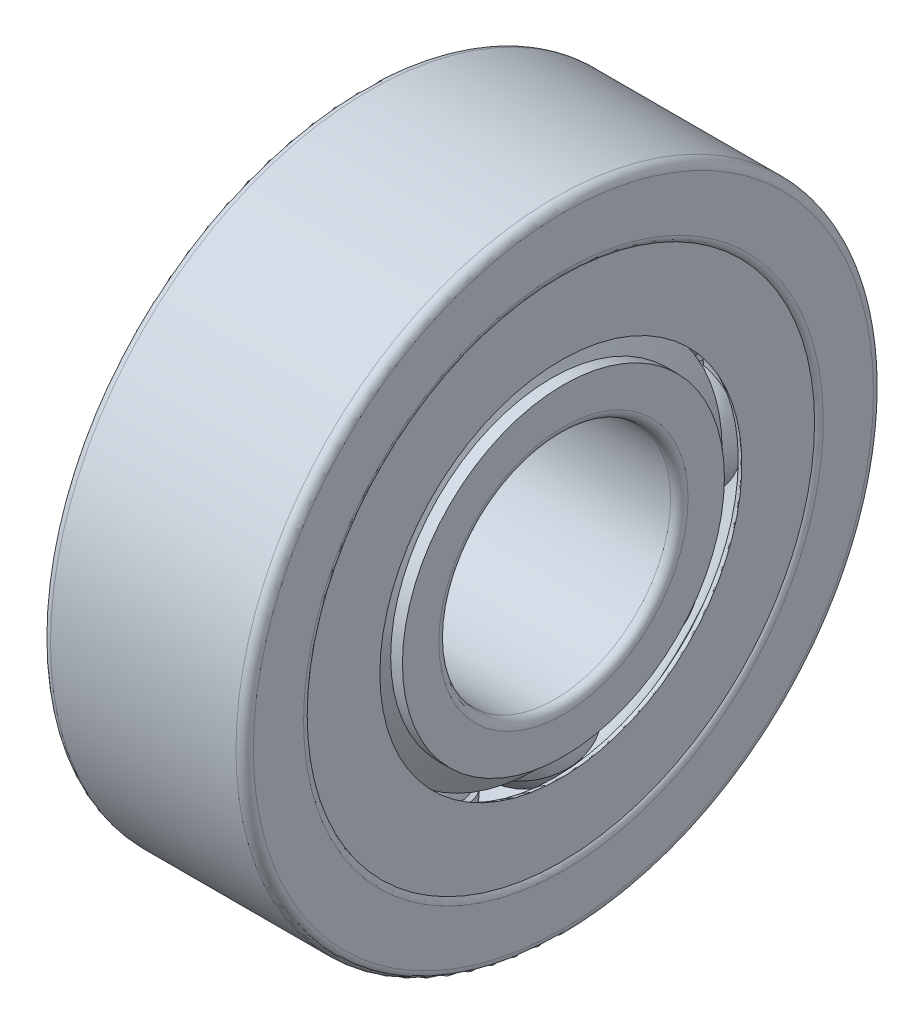
from build123d import *

# Parameters (mm, degrees)
SKETCH_5_W               = 1.05
SKETCH_5_H               = 0.7
PATTERN_CIRCULAR_5_COUNT = 11
PATTERN_CIRCULAR_2_COUNT = 11


with BuildPart() as part:
    # 草图2 → 旋转1 (revolve)
    with BuildSketch(Plane.XY):
        with BuildLine():
            Line((2.644444444, 6.333333333), (3.093494654, 5.555555556))
            Line((3.093494654, 5.555555556), (3.5, 5.555555556))
            Line((3.5, 5.555555556), (3.5, 4.3))
            ThreePointArc((3.5, 4.3), (3.412132034, 4.087867966), (3.2, 4))
            Line((3.2, 4), (-3.2, 4))
            ThreePointArc((-3.2, 4), (-3.412132034, 4.087867966), (-3.5, 4.3))
            Line((-3.5, 4.3), (-3.5, 5.555555556))
            Line((-3.5, 5.555555556), (-3.093494654, 5.555555556))
            Line((-3.093494654, 5.555555556), (-2.644444444, 6.333333333))
            Line((-2.644444444, 6.333333333), (-1.304372987, 6.333333333))
            ThreePointArc((-1.304372987, 6.333333333), (0, 5.75), (1.304372987, 6.333333333))
            Line((1.304372987, 6.333333333), (2.644444444, 6.333333333))
        make_face()
        with BuildLine():
            Line((-3.5, 10.7), (-3.5, 8.966666667))
            ThreePointArc((-3.5, 8.966666667), (-3.412132034, 8.754534632), (-3.2, 8.666666667))
            Line((-3.2, 8.666666667), (-1.304372987, 8.666666667))
            ThreePointArc((-1.304372987, 8.666666667), (0, 9.25), (1.304372987, 8.666666667))
            Line((1.304372987, 8.666666667), (3.2, 8.666666667))
            ThreePointArc((3.2, 8.666666667), (3.412132034, 8.754534632), (3.5, 8.966666667))
            Line((3.5, 8.966666667), (3.5, 10.7))
            ThreePointArc((3.5, 10.7), (3.412132034, 10.912132034), (3.2, 11))
            Line((3.2, 11), (-3.2, 11))
            ThreePointArc((-3.2, 11), (-3.412132034, 10.912132034), (-3.5, 10.7))
        make_face()
    revolve(axis=Axis((-3.5, 0, 0), (1, 0, 0)))


with BuildPart() as body_2:
    # 草图5 → 旋转3 (revolve)
    with BuildSketch(Plane.XY):
        with Locations((0, 7.5)):
            Rectangle(SKETCH_5_W, SKETCH_5_H)
    revolve(axis=Axis((-19.927092192, 0, 0), (1, 0, 0)))



with BuildPart() as body_3:
    # 草图3 → 旋转2 (revolve)
    with BuildSketch(Plane.XY):
        with BuildLine():
            ThreePointArc((1.925, 7.5), (0, 9.425), (-1.925, 7.5))
            Line((-1.925, 7.5), (1.925, 7.5))
        make_face()
    revolve(axis=Axis((-1.925, 7.5, 0), (1, 0, 0)))


with BuildPart() as pattern_circular_5_1:
    # 阵列(圆周)5: pattern copy
    add(body_3.part.rotate(Axis((-3.85, 0, 0), (1, 0, 0)), 1 * 360 / PATTERN_CIRCULAR_5_COUNT))


with BuildPart() as pattern_circular_5_2:
    # 阵列(圆周)5: pattern copy
    add(body_3.part.rotate(Axis((-3.85, 0, 0), (1, 0, 0)), 2 * 360 / PATTERN_CIRCULAR_5_COUNT))


with BuildPart() as pattern_circular_5_3:
    # 阵列(圆周)5: pattern copy
    add(body_3.part.rotate(Axis((-3.85, 0, 0), (1, 0, 0)), 3 * 360 / PATTERN_CIRCULAR_5_COUNT))


with BuildPart() as pattern_circular_5_4:
    # 阵列(圆周)5: pattern copy
    add(body_3.part.rotate(Axis((-3.85, 0, 0), (1, 0, 0)), 4 * 360 / PATTERN_CIRCULAR_5_COUNT))


with BuildPart() as pattern_circular_5_5:
    # 阵列(圆周)5: pattern copy
    add(body_3.part.rotate(Axis((-3.85, 0, 0), (1, 0, 0)), 5 * 360 / PATTERN_CIRCULAR_5_COUNT))


with BuildPart() as pattern_circular_5_6:
    # 阵列(圆周)5: pattern copy
    add(body_3.part.rotate(Axis((-3.85, 0, 0), (1, 0, 0)), 6 * 360 / PATTERN_CIRCULAR_5_COUNT))


with BuildPart() as pattern_circular_5_7:
    # 阵列(圆周)5: pattern copy
    add(body_3.part.rotate(Axis((-3.85, 0, 0), (1, 0, 0)), 7 * 360 / PATTERN_CIRCULAR_5_COUNT))


with BuildPart() as pattern_circular_5_8:
    # 阵列(圆周)5: pattern copy
    add(body_3.part.rotate(Axis((-3.85, 0, 0), (1, 0, 0)), 8 * 360 / PATTERN_CIRCULAR_5_COUNT))


with BuildPart() as pattern_circular_5_9:
    # 阵列(圆周)5: pattern copy
    add(body_3.part.rotate(Axis((-3.85, 0, 0), (1, 0, 0)), 9 * 360 / PATTERN_CIRCULAR_5_COUNT))


with BuildPart() as pattern_circular_5_10:
    # 阵列(圆周)5: pattern copy
    add(body_3.part.rotate(Axis((-3.85, 0, 0), (1, 0, 0)), 10 * 360 / PATTERN_CIRCULAR_5_COUNT))


with BuildPart() as cut_revolve_1_tool:
    # 草图6 → 切除-旋转1 (revolve)
    with BuildSketch(Plane.XY):
        with BuildLine():
            Line((-1.89291442, 7.85), (1.89291442, 7.85))
            ThreePointArc((1.89291442, 7.85), (0, 9.425), (-1.89291442, 7.85))
        make_face()
        with BuildLine():
            Line((-1.89291442, 7.15), (1.89291442, 7.15))
            ThreePointArc((1.89291442, 7.15), (0, 5.575), (-1.89291442, 7.15))
        make_face()
    revolve(axis=Axis((-19.927092192, 0, 0), (1, 0, 0)))


with BuildPart() as part_1:
    add(part.part)

    # 切除-旋转1: cut by cut_revolve_1_tool
    add(cut_revolve_1_tool.part, mode=Mode.SUBTRACT)

    # 草图9 → 旋转5 (revolve)
    with BuildSketch(Plane.XY):
        with BuildLine():
            Line((3.2, 8.666666667), (3.2, 6.333333333))
            ThreePointArc((3.2, 6.333333333), (3.31480503, 6.310497193), (3.412132034, 6.245465368))
            Line((3.412132034, 6.245465368), (3.412132034, 8.754534632))
            ThreePointArc((3.412132034, 8.754534632), (3.31480503, 8.689502807), (3.2, 8.666666667))
        make_face()
        with BuildLine():
            Line((-3.412132034, 8.754534632), (-3.412132034, 6.245465368))
            ThreePointArc((-3.412132034, 6.245465368), (-3.31480503, 6.310497193), (-3.2, 6.333333333))
            Line((-3.2, 6.333333333), (-3.2, 8.666666667))
            ThreePointArc((-3.2, 8.666666667), (-3.31480503, 8.689502807), (-3.412132034, 8.754534632))
        make_face()
    revolve(axis=Axis((-19.927092192, 0, 0), (1, 0, 0)))


with BuildPart() as body_3_1:
    add(body_3.part)

    # 切除-旋转1: cut by cut_revolve_1_tool
    add(cut_revolve_1_tool.part, mode=Mode.SUBTRACT)


with BuildPart() as pattern_circular_5_1_1:
    add(pattern_circular_5_1.part)

    # 切除-旋转1: cut by cut_revolve_1_tool
    add(cut_revolve_1_tool.part, mode=Mode.SUBTRACT)


with BuildPart() as pattern_circular_5_2_1:
    add(pattern_circular_5_2.part)

    # 切除-旋转1: cut by cut_revolve_1_tool
    add(cut_revolve_1_tool.part, mode=Mode.SUBTRACT)


with BuildPart() as pattern_circular_5_3_1:
    add(pattern_circular_5_3.part)

    # 切除-旋转1: cut by cut_revolve_1_tool
    add(cut_revolve_1_tool.part, mode=Mode.SUBTRACT)


with BuildPart() as pattern_circular_5_4_1:
    add(pattern_circular_5_4.part)

    # 切除-旋转1: cut by cut_revolve_1_tool
    add(cut_revolve_1_tool.part, mode=Mode.SUBTRACT)


with BuildPart() as pattern_circular_5_5_1:
    add(pattern_circular_5_5.part)

    # 切除-旋转1: cut by cut_revolve_1_tool
    add(cut_revolve_1_tool.part, mode=Mode.SUBTRACT)


with BuildPart() as pattern_circular_5_6_1:
    add(pattern_circular_5_6.part)

    # 切除-旋转1: cut by cut_revolve_1_tool
    add(cut_revolve_1_tool.part, mode=Mode.SUBTRACT)


with BuildPart() as pattern_circular_5_7_1:
    add(pattern_circular_5_7.part)

    # 切除-旋转1: cut by cut_revolve_1_tool
    add(cut_revolve_1_tool.part, mode=Mode.SUBTRACT)


with BuildPart() as pattern_circular_5_8_1:
    add(pattern_circular_5_8.part)

    # 切除-旋转1: cut by cut_revolve_1_tool
    add(cut_revolve_1_tool.part, mode=Mode.SUBTRACT)


with BuildPart() as pattern_circular_5_9_1:
    add(pattern_circular_5_9.part)

    # 切除-旋转1: cut by cut_revolve_1_tool
    add(cut_revolve_1_tool.part, mode=Mode.SUBTRACT)


with BuildPart() as pattern_circular_5_10_1:
    add(pattern_circular_5_10.part)

    # 切除-旋转1: cut by cut_revolve_1_tool
    add(cut_revolve_1_tool.part, mode=Mode.SUBTRACT)


with BuildPart() as body_2_1:
    add(body_2.part)

    add(body_3_1.part)  # 旋转4 merges body 3
    # 草图7 → 旋转4 (revolve)
    with BuildSketch(Plane.XY):
        with BuildLine():
            Line((-1.75, 7.5), (1.75, 7.5))
            ThreePointArc((1.75, 7.5), (0, 9.25), (-1.75, 7.5))
        make_face()
    revolve_4 = revolve(axis=Axis((-1.75, 7.5, 0), (1, 0, 0)))

    # 阵列(圆周)2: 旋转4 ×11 about axis
    pattern_circular_2_axis = Axis((-3.85, 0, 0), (1, 0, 0))
    for i in range(1, PATTERN_CIRCULAR_2_COUNT):
        add(revolve_4.rotate(pattern_circular_2_axis, i * 360 / PATTERN_CIRCULAR_2_COUNT))


solid = Compound([part_1.part, pattern_circular_5_1_1.part, pattern_circular_5_2_1.part, pattern_circular_5_3_1.part, pattern_circular_5_4_1.part, pattern_circular_5_5_1.part, pattern_circular_5_6_1.part, pattern_circular_5_7_1.part, pattern_circular_5_8_1.part, pattern_circular_5_9_1.part, pattern_circular_5_10_1.part, body_2_1.part])
